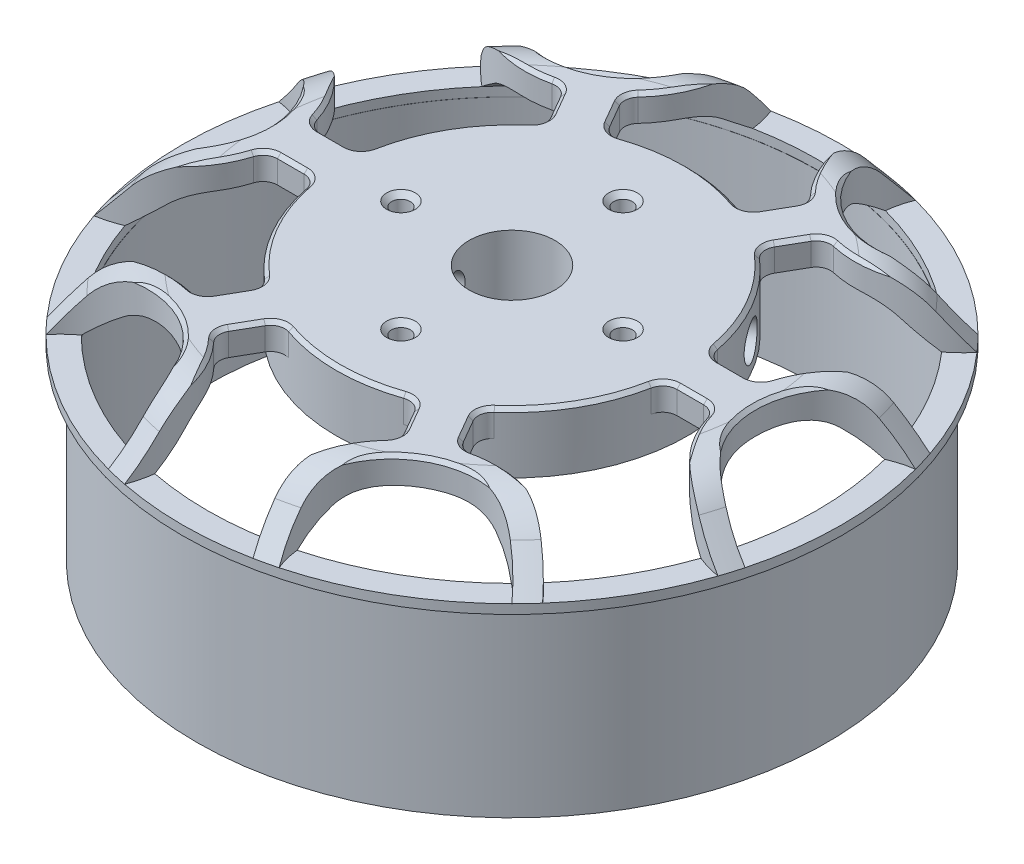
from build123d import *
from OCP.BRepAlgoAPI import BRepAlgoAPI_Cut
from OCP.TopTools import TopTools_ListOfShape

# Parameters (mm, degrees)
SKICA1_R                 = 44
SKICA1_R_2               = 42.5
P_IDAT_VYSUNUT_M1_DEPTH  = 27.3
P_IDAT_START             = -1.3
SKICA2_R                 = 46
SKICA2_R_2               = 44
P_IDAT_VYSUNUT_M2_DEPTH  = 1.3
SKICA3_R                 = 46
P_IDAT_VYSUNUT_M3_DEPTH  = 8.4
ODEBRAT_START            = -8.4
ODEBRAT_VYSUNUT_M2_DEPTH = 8.4
SKICA7_R                 = 1.3
SKICA7_R_2               = 6
ODEBRAT_VYSUNUT_M3_DEPTH = 75.205727542
SKICA9_R                 = 10
SKICA9_R_2               = 6
P_IDAT_VYSUNUT_M4_DEPTH  = 10.3
ZKOSEN_1_SIZE            = 0.5
ZKOSEN_2_SIZE            = 0.7
ZKOSEN_3_SIZE            = 1
M6_Z_VIT1_D              = 5


with BuildPart() as part:
    # Skica1 → Přidat vysunutím1 (new body)
    with BuildSketch(Plane(origin=(0, 0, 0), x_dir=(1, 0, 0), z_dir=(0, 1, 0))):
        with Locations(Location((0, 0, 0), (0, 0, 270))):
            Circle(SKICA1_R)
        with Locations(Location((0, 0, 0), (0, 0, 270))):
            Circle(SKICA1_R_2, mode=Mode.SUBTRACT)
    extrude(amount=P_IDAT_VYSUNUT_M1_DEPTH)

    # Skica2 → Přidat vysunutím2 (add)
    with BuildSketch(Plane(origin=(0, 27.3, 0), x_dir=(1, 0, 0), z_dir=(0, 1, 0)).offset(P_IDAT_START)):
        with Locations(Location((0, 0, 0), (0, 0, 270))):
            Circle(SKICA2_R)
        with Locations(Location((0, 0, 0), (0, 0, 270))):
            Circle(SKICA2_R_2, mode=Mode.SUBTRACT)
    extrude(amount=P_IDAT_VYSUNUT_M2_DEPTH)

    # Skica3 → Přidat vysunutím3 (add)
    with BuildSketch(Plane(origin=(0, 27.3, 0), x_dir=(1, 0, 0), z_dir=(0, 1, 0))):
        with Locations(Location((0, 0, 0), (0, 0, 270))):
            Circle(SKICA3_R)
    extrude(amount=P_IDAT_VYSUNUT_M3_DEPTH)

    # Skica5 → Odebrat rotací1 (revolve, cut)
    with BuildSketch(Plane(origin=(0, 0, 0), x_dir=(0, 0, -1), z_dir=(1, 0, 0)), mode=Mode.PRIVATE) as odebrat_rotac_1_sk:
        with BuildLine():
            Line((-34.288, 35.7), (-46, 35.7))
            Line((-46, 35.7), (-46, 27.3))
            Line((-46, 27.3), (-41.948064338, 32.128329047))
            ThreePointArc((-41.948064338, 32.128329047), (-38.513914666, 34.763202813), (-34.288, 35.7))
        make_face()
    revolve(odebrat_rotac_1_sk.sketch.rotate(Axis((0, 0, 0), (0, 1, 0)), 180), axis=Axis((0, 0, 0), (0, 1, 0)), mode=Mode.SUBTRACT)

    # Skica6 → Odebrat vysunutím2 (cut)
    with BuildSketch(Plane(origin=(0, 35.7, 0), x_dir=(1, 0, 0), z_dir=(0, 1, 0)).offset(ODEBRAT_START)):
        with BuildLine():
            Line((-15.610089891, 21.037468802), (-17.474037806, 24.265921293))
            ThreePointArc((-17.474037806, 24.265921293), (-18.406916047, 25.099312471), (-19.65243113, 25.215479797))
            ThreePointArc((-19.65243113, 25.215479797), (-27.84898156, 25.642543611), (-34.593729187, 30.319530025))
            ThreePointArc((-34.593729187, 30.319530025), (-39.837168574, 23), (-43.554347826, 14.799283275))
            ThreePointArc((-43.554347826, 14.799283275), (-36.131584966, 11.296653695), (-31.663461639, 4.411764706))
            ThreePointArc((-31.663461639, 4.411764706), (-30.940100242, 3.391200667), (-29.751923191, 3))
            Line((-29.751923191, 3), (-26.024027359, 3))
            ThreePointArc((-26.024027359, 3), (-24.750197893, 3.458131494), (-24.059949823, 4.622641509))
            ThreePointArc((-24.059949823, 4.622641509), (-21.217622393, 12.25), (-16.033299891, 18.525207006))
            ThreePointArc((-16.033299891, 18.525207006), (-15.36992867, 19.705234377), (-15.610089891, 21.037468802))
        make_face()
        with BuildLine():
            Line((10.413937468, 24.037468802), (12.277885383, 27.265921293))
            ThreePointArc((12.277885383, 27.265921293), (12.533184194, 28.490513138), (12.011030508, 29.627244503))
            ThreePointArc((12.011030508, 29.627244503), (8.282603404, 36.939197306), (8.960618639, 45.1188133))
            ThreePointArc((8.960618639, 45.1188133), (0, 46), (-8.960618639, 45.1188133))
            ThreePointArc((-8.960618639, 45.1188133), (-8.282603405, 36.939197307), (-12.011030509, 29.627244504))
            ThreePointArc((-12.011030509, 29.627244504), (-12.533184194, 28.490513139), (-12.277885384, 27.265921295))
            Line((-12.277885384, 27.265921295), (-10.413937468, 24.037468802))
            ThreePointArc((-10.413937468, 24.037468802), (-9.380269223, 23.163365871), (-8.026649932, 23.147848515))
            ThreePointArc((-8.026649932, 23.147848515), (0, 24.5), (8.026649932, 23.147848515))
            ThreePointArc((8.026649932, 23.147848515), (9.380269223, 23.163365871), (10.413937468, 24.037468802))
        make_face()
        with BuildLine():
            Line((26.024027359, 3), (29.751923189, 3))
            ThreePointArc((29.751923189, 3), (30.940100241, 3.391200667), (31.663461637, 4.411764706))
            ThreePointArc((31.663461637, 4.411764706), (36.131584965, 11.296653695), (43.554347826, 14.799283275))
            ThreePointArc((43.554347826, 14.799283275), (39.837168574, 23), (34.593729187, 30.319530025))
            ThreePointArc((34.593729187, 30.319530025), (27.84898156, 25.642543612), (19.65243113, 25.215479798))
            ThreePointArc((19.65243113, 25.215479798), (18.406916048, 25.099312472), (17.474037807, 24.265921295))
            Line((17.474037807, 24.265921295), (15.610089891, 21.037468802))
            ThreePointArc((15.610089891, 21.037468802), (15.36992867, 19.705234377), (16.033299891, 18.525207006))
            ThreePointArc((16.033299891, 18.525207006), (21.217622393, 12.25), (24.059949823, 4.622641509))
            ThreePointArc((24.059949823, 4.622641509), (24.750197893, 3.458131494), (26.024027359, 3))
        make_face()
        with BuildLine():
            Line((15.610089891, -21.037468802), (17.474037806, -24.265921293))
            ThreePointArc((17.474037806, -24.265921293), (18.406916047, -25.099312471), (19.65243113, -25.215479797))
            ThreePointArc((19.65243113, -25.215479797), (27.84898156, -25.642543611), (34.593729187, -30.319530025))
            ThreePointArc((34.593729187, -30.319530025), (39.837168574, -23), (43.554347826, -14.799283275))
            ThreePointArc((43.554347826, -14.799283275), (36.131584966, -11.296653695), (31.663461639, -4.411764706))
            ThreePointArc((31.663461639, -4.411764706), (30.940100242, -3.391200667), (29.751923191, -3))
            Line((29.751923191, -3), (26.024027359, -3))
            ThreePointArc((26.024027359, -3), (24.750197893, -3.458131494), (24.059949823, -4.622641509))
            ThreePointArc((24.059949823, -4.622641509), (21.217622393, -12.25), (16.033299891, -18.525207006))
            ThreePointArc((16.033299891, -18.525207006), (15.36992867, -19.705234377), (15.610089891, -21.037468802))
        make_face()
        with BuildLine():
            Line((-10.413937468, -24.037468802), (-12.277885383, -27.265921293))
            ThreePointArc((-12.277885383, -27.265921293), (-12.533184194, -28.490513138), (-12.011030508, -29.627244503))
            ThreePointArc((-12.011030508, -29.627244503), (-8.282603404, -36.939197306), (-8.960618639, -45.1188133))
            ThreePointArc((-8.960618639, -45.1188133), (0, -46), (8.960618639, -45.1188133))
            ThreePointArc((8.960618639, -45.1188133), (8.282603405, -36.939197307), (12.011030509, -29.627244504))
            ThreePointArc((12.011030509, -29.627244504), (12.533184194, -28.490513139), (12.277885384, -27.265921295))
            Line((12.277885384, -27.265921295), (10.413937468, -24.037468802))
            ThreePointArc((10.413937468, -24.037468802), (9.380269223, -23.163365871), (8.026649932, -23.147848515))
            ThreePointArc((8.026649932, -23.147848515), (0, -24.5), (-8.026649932, -23.147848515))
            ThreePointArc((-8.026649932, -23.147848515), (-9.380269223, -23.163365871), (-10.413937468, -24.037468802))
        make_face()
        with BuildLine():
            Line((-26.024027359, -3), (-29.751923189, -3))
            ThreePointArc((-29.751923189, -3), (-30.940100241, -3.391200667), (-31.663461637, -4.411764706))
            ThreePointArc((-31.663461637, -4.411764706), (-36.131584965, -11.296653695), (-43.554347826, -14.799283275))
            ThreePointArc((-43.554347826, -14.799283275), (-39.837168574, -23), (-34.593729187, -30.319530025))
            ThreePointArc((-34.593729187, -30.319530025), (-27.84898156, -25.642543612), (-19.65243113, -25.215479798))
            ThreePointArc((-19.65243113, -25.215479798), (-18.406916048, -25.099312472), (-17.474037807, -24.265921295))
            Line((-17.474037807, -24.265921295), (-15.610089891, -21.037468802))
            ThreePointArc((-15.610089891, -21.037468802), (-15.36992867, -19.705234377), (-16.033299891, -18.525207006))
            ThreePointArc((-16.033299891, -18.525207006), (-21.217622393, -12.25), (-24.059949823, -4.622641509))
            ThreePointArc((-24.059949823, -4.622641509), (-24.750197893, -3.458131494), (-26.024027359, -3))
        make_face()
        with BuildLine():
            ThreePointArc((-44.434782609, 11.897482697), (-34, 0), (-44.434782609, -11.897482697))
            ThreePointArc((-44.434782609, -11.897482697), (-46, 0), (-44.434782609, 11.897482697))
        make_face()
        with BuildLine():
            ThreePointArc((-11.913869048, 44.430391899), (-17, 29.444863729), (-32.520913561, 32.532909202))
            ThreePointArc((-32.520913561, 32.532909202), (-23, 39.837168574), (-11.913869048, 44.430391899))
        make_face()
        with BuildLine():
            ThreePointArc((32.520913561, 32.532909202), (17, 29.444863729), (11.913869048, 44.430391899))
            ThreePointArc((11.913869048, 44.430391899), (23, 39.837168574), (32.520913561, 32.532909202))
        make_face()
        with BuildLine():
            ThreePointArc((44.434782609, -11.897482697), (34, 0), (44.434782609, 11.897482697))
            ThreePointArc((44.434782609, 11.897482697), (46, 0), (44.434782609, -11.897482697))
        make_face()
        with BuildLine():
            ThreePointArc((11.913869048, -44.430391899), (17, -29.444863729), (32.520913561, -32.532909202))
            ThreePointArc((32.520913561, -32.532909202), (23, -39.837168574), (11.913869048, -44.430391899))
        make_face()
        with BuildLine():
            ThreePointArc((-32.520913561, -32.532909202), (-17, -29.444863729), (-11.913869048, -44.430391899))
            ThreePointArc((-11.913869048, -44.430391899), (-23, -39.837168574), (-32.520913561, -32.532909202))
        make_face()
    extrude(amount=ODEBRAT_VYSUNUT_M2_DEPTH, mode=Mode.SUBTRACT)

    # Skica7 → Odebrat vysunutím3 (cut, through all)
    with BuildSketch(Plane(origin=(0, 35.7, 0), x_dir=(1, 0, 0), z_dir=(0, 1, 0))):
        with Locations(Location((0, 15.5, 0), (0, 0, 270))):
            Circle(SKICA7_R)
        with Locations(Location((15.5, 0, 0), (0, 0, 270))):
            Circle(SKICA7_R)
        with Locations(Location((0, -15.5, 0), (0, 0, 270))):
            Circle(SKICA7_R)
        with Locations(Location((-15.5, 0, 0), (0, 0, 270))):
            Circle(SKICA7_R)
        with Locations(Location((0, 0, 0), (0, 0, 270))):
            Circle(SKICA7_R_2)
    extrude(amount=-ODEBRAT_VYSUNUT_M3_DEPTH, mode=Mode.SUBTRACT)

    # Skica9 → Přidat vysunutím4 (add)
    with BuildSketch(Plane.XZ.offset(-27.3)):
        with Locations(Location((0, 0, 0), (0, 0, 90))):
            Circle(SKICA9_R)
        with Locations(Location((0, 0, 0), (0, 0, 90))):
            Circle(SKICA9_R_2, mode=Mode.SUBTRACT)
    extrude(amount=P_IDAT_VYSUNUT_M4_DEPTH)

    # Skica10 → Odebrat rotací2 (revolve, cut)
    with BuildSketch(Plane(origin=(0, 0, 0), x_dir=(0, 0, -1), z_dir=(1, 0, 0))):
        with BuildLine():
            Line((-24.5, 27.3), (-24.5, 32.030323323))
            Line((-24.5, 32.030323323), (-34.288, 32.030323323))
            ThreePointArc((-34.288, 32.030323323), (-36.424890419, 31.669028344), (-38.324227676, 30.625307734))
            Line((-38.324227676, 30.625307734), (-42.521808295, 27.3))
            Line((-42.521808295, 27.3), (-42.521808295, 26))
            Line((-42.521808295, 26), (-24.5, 26))
            Line((-24.5, 26), (-24.5, 27.3))
        make_face()
    revolve(axis=Axis((0, 0, 0), (0, 1, 0)), mode=Mode.SUBTRACT)

    # Zkosení1
    # the kernel refuses this chamfer: 0.5 mm, written as the material it takes off along each edge
    with BuildSketch(Plane(origin=(-45.999999999, 35.7, 0), x_dir=(0.9557692240704767, 0, 0.294117647072934), z_dir=(0.294117647072934, 0, -0.9557692240704767))) as zkosen_1_piece_1:
        Polygon((15, ZKOSEN_1_SIZE), (15 - ZKOSEN_1_SIZE, 0), (15, 0), align=None)
    revolve(axis=Axis((-45.999999999, 35.7, 0), (0, -1, 0)), revolution_arc=39.840972822, mode=Mode.SUBTRACT)
    with BuildSketch(Plane(origin=(-29.751923189, 35.7, 5), x_dir=(0, 0, -1), z_dir=(1, 0, 0))) as zkosen_1_piece_2:
        Polygon((2 + ZKOSEN_1_SIZE, 0), (2, -ZKOSEN_1_SIZE), (2, 0), align=None)
    revolve(axis=Axis((-29.751923189, 35.7, 5), (0, 1, 0)), revolution_arc=72.895364823, mode=Mode.SUBTRACT)
    with BuildSketch(Plane(origin=(-26.024027359, 35.7, 3), x_dir=(0, 0, -1), z_dir=(-1, 0, 0))) as zkosen_1_piece_3:
        Polygon((ZKOSEN_1_SIZE, 0), (0, ZKOSEN_1_SIZE), (0, 0), align=None)
    extrude(amount=3.72789583, mode=Mode.SUBTRACT)
    with BuildSketch(Plane(origin=(-23, 35.7, 39.837168574), x_dir=(-0.45314444531762665, 0, -0.8914371047234799), z_dir=(-0.8914371047234799, 0, 0.45314444531762665))) as zkosen_1_piece_4:
        Polygon((15, ZKOSEN_1_SIZE), (15 - ZKOSEN_1_SIZE, 0), (15, 0), align=None)
    revolve(axis=Axis((-23, 35.7, 39.837168574), (0, -1, 0)), revolution_arc=39.840972815, mode=Mode.SUBTRACT)
    with BuildSketch(Plane(origin=(-19.206088614, 35.7, 23.265921295), x_dir=(-0.22317125798319623, 0, 0.9747792517335387), z_dir=(-0.9747792517335387, 0, -0.22317125798319623))) as zkosen_1_piece_5:
        Polygon((2 + ZKOSEN_1_SIZE, 0), (2, -ZKOSEN_1_SIZE), (2, 0), align=None)
    revolve(axis=Axis((-19.206088614, 35.7, 23.265921295), (0, 1, 0)), revolution_arc=72.895364823, mode=Mode.SUBTRACT)
    with BuildSketch(Plane(origin=(-17.474037807, 35.7, 24.265921295), x_dir=(0.8660254037844303, 0, 0.5000000000000144), z_dir=(0.5000000000000145, 0, -0.8660254037844304))) as zkosen_1_piece_6:
        Polygon((ZKOSEN_1_SIZE, 0), (0, ZKOSEN_1_SIZE), (0, 0), align=None)
    extrude(amount=3.727895831, mode=Mode.SUBTRACT)
    with BuildSketch(Plane(origin=(0, 35.7, 0), x_dir=(-0.6544204037205466, 0, 0.7561308981877655), z_dir=(0.7561308981877655, 0, 0.6544204037205466))) as zkosen_1_piece_7:
        Polygon((24.5 - ZKOSEN_1_SIZE, 0), (24.5, ZKOSEN_1_SIZE), (24.5, 0), align=None)
    revolve(axis=Axis((0, 35.7, 0), (0, -1, 0)), revolution_arc=38.248567011, mode=Mode.SUBTRACT)
    with BuildSketch(Plane(origin=(-46, 35.7, 0), x_dir=(0.7486212377968893, 0, -0.6629979202979852), z_dir=(-0.6629979202979852, 0, -0.7486212377968893))) as zkosen_1_piece_8:
        Polygon((12, ZKOSEN_1_SIZE), (12 + ZKOSEN_1_SIZE, 0), (12, 0), align=None)
    revolve(axis=Axis((-46, 35.7, 0), (0, -1, 0)), revolution_arc=83.057828013, mode=Mode.SUBTRACT)
    with BuildSketch(Plane(origin=(-17.342140699, 35.7, 20.037468802), x_dir=(0.8660254037843677, 0, 0.5000000000001229), z_dir=(-0.5000000000001229, 0, 0.8660254037843677))) as zkosen_1_piece_9:
        Polygon((2 + ZKOSEN_1_SIZE, 0), (2, -ZKOSEN_1_SIZE), (2, 0), align=None)
    revolve(axis=Axis((-17.342140699, 35.7, 20.037468802), (0, 1, 0)), revolution_arc=79.124283505, mode=Mode.SUBTRACT)
    with BuildSketch(Plane(origin=(-26.024027359, 35.7, 5), x_dir=(0.9820387682772246, 0, -0.18867924528297125), z_dir=(0.18867924528297125, 0, 0.9820387682772246))) as zkosen_1_piece_10:
        Polygon((2 + ZKOSEN_1_SIZE, 0), (2, -ZKOSEN_1_SIZE), (2, 0), align=None)
    revolve(axis=Axis((-26.024027359, 35.7, 5), (0, 1, 0)), revolution_arc=79.124283505, mode=Mode.SUBTRACT)


with BuildPart() as kruhov_pole1_tool:
    # Kruhové pole1: read off the stored shape, not the designer's step
    # Kruhové pole1: loft between two sections, ruled curve by curve
    kruhov_pole1_from = [
        Edge.make_three_point_arc((-36.107905282, 35.700000506, -10.601719078), (-33.709192786, 35.700000506, -7.693246607), (-32.141346735, 35.700000506, -4.264705734)),
        Edge.make_three_point_arc((-23.568930439, 35.7, -4.528301887), (-20.784609691, 35.7, -12), (-15.706089689, 35.7, -18.147141557)),
        Edge.make_three_point_arc((-19.764016871, 35.700000506, -25.702869916), (-23.517143392, 35.700000506, -25.346393989), (-27.235310687, 35.700000506, -25.969503712)),
        Edge.make_three_point_arc((-32.141346735, 35.700000506, -4.264705734), (-31.237144505, 35.7, -2.989000834), (-29.751923191, 35.7, -2.5)),
        Edge.make_three_point_arc((-17.041025104, 35.7, -24.515921293), (-18.207122906, 35.7, -25.557660265), (-19.764016871, 35.700000506, -25.702869916)),
        Edge.make_three_point_arc((-15.706089689, 35.7, -18.147141557), (-14.876875662, 35.7, -19.622175771), (-15.177077189, 35.7, -21.287468802)),
        Edge.make_three_point_arc((-26.024027359, 35.7, -2.5), (-24.431740526, 35.7, -3.072664367), (-23.568930439, 35.7, -4.528301887)),
        Edge.make_line((-17.041025104, 35.7, -24.515921293), (-15.177077189, 35.7, -21.287468802)),
        Edge.make_line((-29.751923191, 35.7, -2.5), (-26.024027359, 35.7, -2.5)),
        Edge.make_line((-27.235310687, 35.700000506, -25.969503712), (-36.107905282, 35.700000506, -10.601719078)),
    ]
    kruhov_pole1_to = [
        Edge.make_three_point_arc((-35.766798211, 35.2, -10.967295981), (-33.285371404, 35.2, -7.95853125), (-31.663461639, 35.2, -4.411764706)),
        Edge.make_three_point_arc((-24.059949823, 35.2, -4.622641509), (-21.217622393, 35.2, -12.25), (-16.033299891, 35.2, -18.525207006)),
        Edge.make_three_point_arc((-19.65243113, 35.2, -25.215479797), (-23.534975941, 35.2, -24.846711584), (-27.381356036, 35.2, -25.491307871)),
        Edge.make_three_point_arc((-31.663461639, 35.2, -4.411764706), (-30.940100242, 35.2, -3.391200667), (-29.751923191, 35.2, -3)),
        Edge.make_three_point_arc((-17.474037806, 35.2, -24.265921293), (-18.406916047, 35.2, -25.099312471), (-19.65243113, 35.2, -25.215479797)),
        Edge.make_three_point_arc((-16.033299891, 35.2, -18.525207006), (-15.36992867, 35.2, -19.705234377), (-15.610089891, 35.2, -21.037468802)),
        Edge.make_three_point_arc((-26.024027359, 35.2, -3), (-24.750197893, 35.2, -3.458131494), (-24.059949823, 35.2, -4.622641509)),
        Edge.make_line((-17.474037806, 35.2, -24.265921293), (-15.610089891, 35.2, -21.037468802)),
        Edge.make_line((-29.751923191, 35.2, -3), (-26.024027359, 35.2, -3)),
        Edge.make_line((-27.381356036, 35.2, -25.491307871), (-35.766798211, 35.2, -10.967295981)),
    ]
    kruhov_pole1 = Solid(Shell([*[Face.make_surface_from_curves(kruhov_pole1_from[k], kruhov_pole1_to[k]) for k in range(10)], Face(Wire(kruhov_pole1_from)), Face(Wire(kruhov_pole1_to))]))
    add(kruhov_pole1)


with BuildPart() as part_1:
    add(part.part)

    # Kruhové pole1: cut by kruhov_pole1_tool, with a tolerance
    kruhov_pole1_stock = TopTools_ListOfShape()
    kruhov_pole1_stock.Append(part_1.part.wrapped)
    kruhov_pole1_tools = TopTools_ListOfShape()
    kruhov_pole1_tools.Append(kruhov_pole1_tool.part.wrapped)
    kruhov_pole1_cut = BRepAlgoAPI_Cut()
    kruhov_pole1_cut.SetArguments(kruhov_pole1_stock)
    kruhov_pole1_cut.SetTools(kruhov_pole1_tools)
    kruhov_pole1_cut.SetFuzzyValue(0.00001)
    kruhov_pole1_cut.Build()
    add(Compound.cast(kruhov_pole1_cut.Shape()).solids(), mode=Mode.REPLACE)


with BuildPart() as kruhov_pole1_2_tool:
    # Kruhov_ pole1 2: loft between two sections, ruled curve by curve
    kruhov_pole1_2_from = [
        Edge.make_three_point_arc((-12.377329862, 35.700000506, 29.96757565), (-10.192049393, 35.700000506, 33.039640596), (-8.872594595, 35.700000506, 36.571222791)),
        Edge.make_three_point_arc((7.862840749, 35.7, 22.675443443), (0, 35.7, 24), (-7.862840749, 35.7, 22.675443443)),
        Edge.make_three_point_arc((8.872594595, 35.700000506, 36.571222791), (10.192049394, 35.700000506, 33.039640597), (12.377329862, 35.700000506, 29.967575651)),
        Edge.make_three_point_arc((12.377329862, 35.700000506, 29.967575651), (13.030021599, 35.7, 28.5466611), (12.710898086, 35.7, 27.015921295)),
        Edge.make_three_point_arc((-12.710898085, 35.7, 27.015921293), (-13.030021598, 35.7, 28.546661099), (-12.377329862, 35.700000506, 29.96757565)),
        Edge.make_three_point_arc((-7.862840749, 35.7, 22.675443443), (-9.554864864, 35.7, 22.694840138), (-10.84695017, 35.7, 23.787468802)),
        Edge.make_three_point_arc((10.84695017, 35.7, 23.787468802), (9.554864864, 35.7, 22.694840138), (7.862840749, 35.7, 22.675443443)),
        Edge.make_line((12.710898086, 35.7, 27.015921295), (10.84695017, 35.7, 23.787468802)),
        Edge.make_line((-12.710898085, 35.7, 27.015921293), (-10.84695017, 35.7, 23.787468802)),
        Edge.make_line((8.872594595, 35.700000506, 36.571222791), (-8.872594595, 35.700000506, 36.571222791)),
    ]
    kruhov_pole1_2_to = [
        Edge.make_three_point_arc((-12.011030508, 35.2, 29.627244503), (-9.750395462, 35.2, 32.805242834), (-8.385442174, 35.2, 36.458603853)),
        Edge.make_three_point_arc((8.026649932, 35.2, 23.147848515), (0, 35.2, 24.5), (-8.026649932, 35.2, 23.147848515)),
        Edge.make_three_point_arc((8.385442175, 35.2, 36.458603853), (9.750395462, 35.2, 32.805242835), (12.011030509, 35.2, 29.627244504)),
        Edge.make_three_point_arc((12.011030509, 35.2, 29.627244504), (12.533184194, 35.2, 28.490513139), (12.277885384, 35.2, 27.265921295)),
        Edge.make_three_point_arc((-12.277885383, 35.2, 27.265921293), (-12.533184194, 35.2, 28.490513138), (-12.011030508, 35.2, 29.627244503)),
        Edge.make_three_point_arc((-8.026649932, 35.2, 23.147848515), (-9.380269223, 35.2, 23.163365871), (-10.413937468, 35.2, 24.037468802)),
        Edge.make_three_point_arc((10.413937468, 35.2, 24.037468802), (9.380269223, 35.2, 23.163365871), (8.026649932, 35.2, 23.147848515)),
        Edge.make_line((12.277885384, 35.2, 27.265921295), (10.413937468, 35.2, 24.037468802)),
        Edge.make_line((-12.277885383, 35.2, 27.265921293), (-10.413937468, 35.2, 24.037468802)),
        Edge.make_line((8.385442175, 35.2, 36.458603853), (-8.385442174, 35.2, 36.458603853)),
    ]
    kruhov_pole1_2 = Solid(Shell([*[Face.make_surface_from_curves(kruhov_pole1_2_from[k], kruhov_pole1_2_to[k]) for k in range(10)], Face(Wire(kruhov_pole1_2_from)), Face(Wire(kruhov_pole1_2_to))]))
    add(kruhov_pole1_2)


with BuildPart() as part_2:
    add(part_1.part)

    # Kruhov_ pole1 2: cut by kruhov_pole1_2_tool, with a tolerance
    kruhov_pole1_2_stock = TopTools_ListOfShape()
    kruhov_pole1_2_stock.Append(part_2.part.wrapped)
    kruhov_pole1_2_tools = TopTools_ListOfShape()
    kruhov_pole1_2_tools.Append(kruhov_pole1_2_tool.part.wrapped)
    kruhov_pole1_2_cut = BRepAlgoAPI_Cut()
    kruhov_pole1_2_cut.SetArguments(kruhov_pole1_2_stock)
    kruhov_pole1_2_cut.SetTools(kruhov_pole1_2_tools)
    kruhov_pole1_2_cut.SetFuzzyValue(0.00001)
    kruhov_pole1_2_cut.Build()
    add(Compound.cast(kruhov_pole1_2_cut.Shape()).solids(), mode=Mode.REPLACE)


with BuildPart() as kruhov_pole1_3_tool:
    # Kruhov_ pole1 3: loft between two sections, ruled curve by curve
    kruhov_pole1_3_from = [
        Edge.make_three_point_arc((23.568930439, 35.7, 4.528301887), (20.784609691, 35.7, 12), (15.706089689, 35.7, 18.147141557)),
        Edge.make_three_point_arc((19.764016871, 35.700000506, 25.702869916), (23.517143392, 35.700000506, 25.346393989), (27.235310687, 35.700000506, 25.969503712)),
        Edge.make_three_point_arc((36.107905282, 35.700000506, 10.601719078), (33.709192786, 35.700000506, 7.693246607), (32.141346735, 35.700000506, 4.264705734)),
        Edge.make_three_point_arc((32.141346735, 35.700000506, 4.264705734), (31.237144505, 35.7, 2.989000834), (29.751923191, 35.7, 2.5)),
        Edge.make_three_point_arc((17.041025104, 35.7, 24.515921293), (18.207122906, 35.7, 25.557660265), (19.764016871, 35.700000506, 25.702869916)),
        Edge.make_three_point_arc((15.706089689, 35.7, 18.147141557), (14.876875662, 35.7, 19.622175771), (15.177077189, 35.7, 21.287468802)),
        Edge.make_three_point_arc((26.024027359, 35.7, 2.5), (24.431740526, 35.7, 3.072664367), (23.568930439, 35.7, 4.528301887)),
        Edge.make_line((29.751923191, 35.7, 2.5), (26.024027359, 35.7, 2.5)),
        Edge.make_line((17.041025104, 35.7, 24.515921293), (15.177077189, 35.7, 21.287468802)),
        Edge.make_line((36.107905282, 35.700000506, 10.601719078), (27.235310687, 35.700000506, 25.969503712)),
    ]
    kruhov_pole1_3_to = [
        Edge.make_three_point_arc((24.059949823, 35.2, 4.622641509), (21.217622393, 35.2, 12.25), (16.033299891, 35.2, 18.525207006)),
        Edge.make_three_point_arc((19.65243113, 35.2, 25.215479797), (23.534975941, 35.2, 24.846711584), (27.381356036, 35.2, 25.491307871)),
        Edge.make_three_point_arc((35.766798211, 35.2, 10.967295981), (33.285371404, 35.2, 7.95853125), (31.663461639, 35.2, 4.411764706)),
        Edge.make_three_point_arc((31.663461639, 35.2, 4.411764706), (30.940100242, 35.2, 3.391200667), (29.751923191, 35.2, 3)),
        Edge.make_three_point_arc((17.474037806, 35.2, 24.265921293), (18.406916047, 35.2, 25.099312471), (19.65243113, 35.2, 25.215479797)),
        Edge.make_three_point_arc((16.033299891, 35.2, 18.525207006), (15.36992867, 35.2, 19.705234377), (15.610089891, 35.2, 21.037468802)),
        Edge.make_three_point_arc((26.024027359, 35.2, 3), (24.750197893, 35.2, 3.458131494), (24.059949823, 35.2, 4.622641509)),
        Edge.make_line((29.751923191, 35.2, 3), (26.024027359, 35.2, 3)),
        Edge.make_line((17.474037806, 35.2, 24.265921293), (15.610089891, 35.2, 21.037468802)),
        Edge.make_line((35.766798211, 35.2, 10.967295981), (27.381356036, 35.2, 25.491307871)),
    ]
    kruhov_pole1_3 = Solid(Shell([*[Face.make_surface_from_curves(kruhov_pole1_3_from[k], kruhov_pole1_3_to[k]) for k in range(10)], Face(Wire(kruhov_pole1_3_from)), Face(Wire(kruhov_pole1_3_to))]))
    add(kruhov_pole1_3)


with BuildPart() as part_3:
    add(part_2.part)

    # Kruhov_ pole1 3: cut by kruhov_pole1_3_tool, with a tolerance
    kruhov_pole1_3_stock = TopTools_ListOfShape()
    kruhov_pole1_3_stock.Append(part_3.part.wrapped)
    kruhov_pole1_3_tools = TopTools_ListOfShape()
    kruhov_pole1_3_tools.Append(kruhov_pole1_3_tool.part.wrapped)
    kruhov_pole1_3_cut = BRepAlgoAPI_Cut()
    kruhov_pole1_3_cut.SetArguments(kruhov_pole1_3_stock)
    kruhov_pole1_3_cut.SetTools(kruhov_pole1_3_tools)
    kruhov_pole1_3_cut.SetFuzzyValue(0.00001)
    kruhov_pole1_3_cut.Build()
    add(Compound.cast(kruhov_pole1_3_cut.Shape()).solids(), mode=Mode.REPLACE)


with BuildPart() as kruhov_pole1_4_tool:
    # Kruhov_ pole1 4: loft between two sections, ruled curve by curve
    kruhov_pole1_4_from = [
        Edge.make_three_point_arc((-7.862840749, 35.7, -22.675443443), (0, 35.7, -24), (7.862840749, 35.7, -22.675443443)),
        Edge.make_three_point_arc((12.377329862, 35.700000506, -29.96757565), (10.192049393, 35.700000506, -33.039640596), (8.872594595, 35.700000506, -36.571222791)),
        Edge.make_three_point_arc((-8.872594595, 35.700000506, -36.571222791), (-10.192049394, 35.700000506, -33.039640597), (-12.377329862, 35.700000506, -29.967575651)),
        Edge.make_three_point_arc((-12.377329862, 35.700000506, -29.967575651), (-13.030021599, 35.7, -28.5466611), (-12.710898086, 35.7, -27.015921295)),
        Edge.make_three_point_arc((12.710898085, 35.7, -27.015921293), (13.030021598, 35.7, -28.546661099), (12.377329862, 35.700000506, -29.96757565)),
        Edge.make_three_point_arc((7.862840749, 35.7, -22.675443443), (9.554864864, 35.7, -22.694840138), (10.84695017, 35.7, -23.787468802)),
        Edge.make_three_point_arc((-10.84695017, 35.7, -23.787468802), (-9.554864864, 35.7, -22.694840138), (-7.862840749, 35.7, -22.675443443)),
        Edge.make_line((12.710898085, 35.7, -27.015921293), (10.84695017, 35.7, -23.787468802)),
        Edge.make_line((-12.710898086, 35.7, -27.015921295), (-10.84695017, 35.7, -23.787468802)),
        Edge.make_line((-8.872594595, 35.700000506, -36.571222791), (8.872594595, 35.700000506, -36.571222791)),
    ]
    kruhov_pole1_4_to = [
        Edge.make_three_point_arc((-8.026649932, 35.2, -23.147848515), (0, 35.2, -24.5), (8.026649932, 35.2, -23.147848515)),
        Edge.make_three_point_arc((12.011030508, 35.2, -29.627244503), (9.750395462, 35.2, -32.805242834), (8.385442174, 35.2, -36.458603853)),
        Edge.make_three_point_arc((-8.385442175, 35.2, -36.458603853), (-9.750395462, 35.2, -32.805242835), (-12.011030509, 35.2, -29.627244504)),
        Edge.make_three_point_arc((-12.011030509, 35.2, -29.627244504), (-12.533184194, 35.2, -28.490513139), (-12.277885384, 35.2, -27.265921295)),
        Edge.make_three_point_arc((12.277885383, 35.2, -27.265921293), (12.533184194, 35.2, -28.490513138), (12.011030508, 35.2, -29.627244503)),
        Edge.make_three_point_arc((8.026649932, 35.2, -23.147848515), (9.380269223, 35.2, -23.163365871), (10.413937468, 35.2, -24.037468802)),
        Edge.make_three_point_arc((-10.413937468, 35.2, -24.037468802), (-9.380269223, 35.2, -23.163365871), (-8.026649932, 35.2, -23.147848515)),
        Edge.make_line((12.277885383, 35.2, -27.265921293), (10.413937468, 35.2, -24.037468802)),
        Edge.make_line((-12.277885384, 35.2, -27.265921295), (-10.413937468, 35.2, -24.037468802)),
        Edge.make_line((-8.385442175, 35.2, -36.458603853), (8.385442174, 35.2, -36.458603853)),
    ]
    kruhov_pole1_4 = Solid(Shell([*[Face.make_surface_from_curves(kruhov_pole1_4_from[k], kruhov_pole1_4_to[k]) for k in range(10)], Face(Wire(kruhov_pole1_4_from)), Face(Wire(kruhov_pole1_4_to))]))
    add(kruhov_pole1_4)


with BuildPart() as part_4:
    add(part_3.part)

    # Kruhov_ pole1 4: cut by kruhov_pole1_4_tool, with a tolerance
    kruhov_pole1_4_stock = TopTools_ListOfShape()
    kruhov_pole1_4_stock.Append(part_4.part.wrapped)
    kruhov_pole1_4_tools = TopTools_ListOfShape()
    kruhov_pole1_4_tools.Append(kruhov_pole1_4_tool.part.wrapped)
    kruhov_pole1_4_cut = BRepAlgoAPI_Cut()
    kruhov_pole1_4_cut.SetArguments(kruhov_pole1_4_stock)
    kruhov_pole1_4_cut.SetTools(kruhov_pole1_4_tools)
    kruhov_pole1_4_cut.SetFuzzyValue(0.00001)
    kruhov_pole1_4_cut.Build()
    add(Compound.cast(kruhov_pole1_4_cut.Shape()).solids(), mode=Mode.REPLACE)


with BuildPart() as kruhov_pole1_5_tool:
    # Kruhov_ pole1 5: loft between two sections, ruled curve by curve
    kruhov_pole1_5_from = [
        Edge.make_three_point_arc((15.706089689, 35.7, -18.147141557), (20.784609691, 35.7, -12), (23.568930439, 35.7, -4.528301887)),
        Edge.make_three_point_arc((32.141346733, 35.700000506, -4.264705733), (33.709192785, 35.700000506, -7.693246607), (36.107905282, 35.700000506, -10.601719079)),
        Edge.make_three_point_arc((27.235310687, 35.700000506, -25.969503713), (23.517143392, 35.700000506, -25.34639399), (19.764016872, 35.700000506, -25.702869917)),
        Edge.make_three_point_arc((19.764016872, 35.700000506, -25.702869917), (18.207122906, 35.7, -25.557660266), (17.041025105, 35.7, -24.515921295)),
        Edge.make_three_point_arc((29.751923189, 35.7, -2.5), (31.237144504, 35.7, -2.989000834), (32.141346733, 35.700000506, -4.264705733)),
        Edge.make_three_point_arc((23.568930439, 35.7, -4.528301887), (24.431740526, 35.7, -3.072664367), (26.024027359, 35.7, -2.5)),
        Edge.make_three_point_arc((15.177077189, 35.7, -21.287468802), (14.876875662, 35.7, -19.622175771), (15.706089689, 35.7, -18.147141557)),
        Edge.make_line((17.041025105, 35.7, -24.515921295), (15.177077189, 35.7, -21.287468802)),
        Edge.make_line((29.751923189, 35.7, -2.5), (26.024027359, 35.7, -2.5)),
        Edge.make_line((27.235310687, 35.700000506, -25.969503713), (36.107905282, 35.700000506, -10.601719079)),
    ]
    kruhov_pole1_5_to = [
        Edge.make_three_point_arc((16.033299891, 35.2, -18.525207006), (21.217622393, 35.2, -12.25), (24.059949823, 35.2, -4.622641509)),
        Edge.make_three_point_arc((31.663461637, 35.2, -4.411764706), (33.285371403, 35.2, -7.958531251), (35.76679821, 35.2, -10.967295982)),
        Edge.make_three_point_arc((27.381356036, 35.2, -25.491307872), (23.534975941, 35.2, -24.846711585), (19.65243113, 35.2, -25.215479798)),
        Edge.make_three_point_arc((19.65243113, 35.2, -25.215479798), (18.406916048, 35.2, -25.099312472), (17.474037807, 35.2, -24.265921295)),
        Edge.make_three_point_arc((29.751923189, 35.2, -3), (30.940100241, 35.2, -3.391200667), (31.663461637, 35.2, -4.411764706)),
        Edge.make_three_point_arc((24.059949823, 35.2, -4.622641509), (24.750197893, 35.2, -3.458131494), (26.024027359, 35.2, -3)),
        Edge.make_three_point_arc((15.610089891, 35.2, -21.037468802), (15.36992867, 35.2, -19.705234377), (16.033299891, 35.2, -18.525207006)),
        Edge.make_line((17.474037807, 35.2, -24.265921295), (15.610089891, 35.2, -21.037468802)),
        Edge.make_line((29.751923189, 35.2, -3), (26.024027359, 35.2, -3)),
        Edge.make_line((27.381356036, 35.2, -25.491307872), (35.76679821, 35.2, -10.967295982)),
    ]
    kruhov_pole1_5 = Solid(Shell([*[Face.make_surface_from_curves(kruhov_pole1_5_from[k], kruhov_pole1_5_to[k]) for k in range(10)], Face(Wire(kruhov_pole1_5_from)), Face(Wire(kruhov_pole1_5_to))]))
    add(kruhov_pole1_5)


with BuildPart() as part_5:
    add(part_4.part)

    # Kruhov_ pole1 5: cut by kruhov_pole1_5_tool, with a tolerance
    kruhov_pole1_5_stock = TopTools_ListOfShape()
    kruhov_pole1_5_stock.Append(part_5.part.wrapped)
    kruhov_pole1_5_tools = TopTools_ListOfShape()
    kruhov_pole1_5_tools.Append(kruhov_pole1_5_tool.part.wrapped)
    kruhov_pole1_5_cut = BRepAlgoAPI_Cut()
    kruhov_pole1_5_cut.SetArguments(kruhov_pole1_5_stock)
    kruhov_pole1_5_cut.SetTools(kruhov_pole1_5_tools)
    kruhov_pole1_5_cut.SetFuzzyValue(0.00001)
    kruhov_pole1_5_cut.Build()
    add(Compound.cast(kruhov_pole1_5_cut.Shape()).solids(), mode=Mode.REPLACE)


with BuildPart() as kruhov_pole1_6_tool:
    # Kruhov_ pole1 6: loft between two sections, ruled curve by curve
    kruhov_pole1_6_from = [
        Edge.make_three_point_arc((-11.812525038, 35.2, 35.496615157), (-17, 35.2, 29.444863729), (-24.834707956, 35.2, 27.978254344)),
        Edge.make_line((-24.834707956, 35.2, 27.978254344), (-11.812525038, 35.2, 35.496615157)),
    ]
    kruhov_pole1_6_to = [
        Edge.make_three_point_arc((-11.346380248, 35.7, 35.315758765), (-16.75, 35.7, 29.011851027), (-24.91115412, 35.7, 27.484132918)),
        Edge.make_line((-24.91115412, 35.7, 27.484132918), (-11.346380248, 35.7, 35.315758765)),
    ]
    kruhov_pole1_6 = Solid(Shell([*[Face.make_surface_from_curves(kruhov_pole1_6_from[k], kruhov_pole1_6_to[k]) for k in range(2)], Face(Wire(kruhov_pole1_6_from)), Face(Wire(kruhov_pole1_6_to))]))
    add(kruhov_pole1_6)


with BuildPart() as part_6:
    add(part_5.part)

    # Kruhov_ pole1 6: cut by kruhov_pole1_6_tool, with a tolerance
    kruhov_pole1_6_stock = TopTools_ListOfShape()
    kruhov_pole1_6_stock.Append(part_6.part.wrapped)
    kruhov_pole1_6_tools = TopTools_ListOfShape()
    kruhov_pole1_6_tools.Append(kruhov_pole1_6_tool.part.wrapped)
    kruhov_pole1_6_cut = BRepAlgoAPI_Cut()
    kruhov_pole1_6_cut.SetArguments(kruhov_pole1_6_stock)
    kruhov_pole1_6_cut.SetTools(kruhov_pole1_6_tools)
    kruhov_pole1_6_cut.SetFuzzyValue(0.00001)
    kruhov_pole1_6_cut.Build()
    add(Compound.cast(kruhov_pole1_6_cut.Shape()).solids(), mode=Mode.REPLACE)


with BuildPart() as kruhov_pole1_7_tool:
    # Kruhov_ pole1 7: loft between two sections, ruled curve by curve
    kruhov_pole1_7_from = [
        Edge.make_three_point_arc((24.834707956, 35.2, 27.978254344), (17, 35.2, 29.444863729), (11.812525038, 35.2, 35.496615157)),
        Edge.make_line((11.812525038, 35.2, 35.496615157), (24.834707956, 35.2, 27.978254344)),
    ]
    kruhov_pole1_7_to = [
        Edge.make_three_point_arc((24.91115412, 35.7, 27.484132918), (16.75, 35.7, 29.011851027), (11.346380248, 35.7, 35.315758765)),
        Edge.make_line((11.346380248, 35.7, 35.315758765), (24.91115412, 35.7, 27.484132918)),
    ]
    kruhov_pole1_7 = Solid(Shell([*[Face.make_surface_from_curves(kruhov_pole1_7_from[k], kruhov_pole1_7_to[k]) for k in range(2)], Face(Wire(kruhov_pole1_7_from)), Face(Wire(kruhov_pole1_7_to))]))
    add(kruhov_pole1_7)


with BuildPart() as part_7:
    add(part_6.part)

    # Kruhov_ pole1 7: cut by kruhov_pole1_7_tool, with a tolerance
    kruhov_pole1_7_stock = TopTools_ListOfShape()
    kruhov_pole1_7_stock.Append(part_7.part.wrapped)
    kruhov_pole1_7_tools = TopTools_ListOfShape()
    kruhov_pole1_7_tools.Append(kruhov_pole1_7_tool.part.wrapped)
    kruhov_pole1_7_cut = BRepAlgoAPI_Cut()
    kruhov_pole1_7_cut.SetArguments(kruhov_pole1_7_stock)
    kruhov_pole1_7_cut.SetTools(kruhov_pole1_7_tools)
    kruhov_pole1_7_cut.SetFuzzyValue(0.00001)
    kruhov_pole1_7_cut.Build()
    add(Compound.cast(kruhov_pole1_7_cut.Shape()).solids(), mode=Mode.REPLACE)


with BuildPart() as kruhov_pole1_8_tool:
    # Kruhov_ pole1 8: loft between two sections, ruled curve by curve
    kruhov_pole1_8_from = [
        Edge.make_three_point_arc((36.647232993, 35.2, -7.518360813), (34, 35.2, 0), (36.647232993, 35.2, 7.518360813)),
        Edge.make_line((36.647232993, 35.2, 7.518360813), (36.647232993, 35.2, -7.518360813)),
    ]
    kruhov_pole1_8_to = [
        Edge.make_three_point_arc((36.257534368, 35.7, -7.831625847), (33.5, 35.7, 0), (36.257534368, 35.7, 7.831625847)),
        Edge.make_line((36.257534368, 35.7, 7.831625847), (36.257534368, 35.7, -7.831625847)),
    ]
    kruhov_pole1_8 = Solid(Shell([*[Face.make_surface_from_curves(kruhov_pole1_8_from[k], kruhov_pole1_8_to[k]) for k in range(2)], Face(Wire(kruhov_pole1_8_from)), Face(Wire(kruhov_pole1_8_to))]))
    add(kruhov_pole1_8)


with BuildPart() as part_8:
    add(part_7.part)

    # Kruhov_ pole1 8: cut by kruhov_pole1_8_tool, with a tolerance
    kruhov_pole1_8_stock = TopTools_ListOfShape()
    kruhov_pole1_8_stock.Append(part_8.part.wrapped)
    kruhov_pole1_8_tools = TopTools_ListOfShape()
    kruhov_pole1_8_tools.Append(kruhov_pole1_8_tool.part.wrapped)
    kruhov_pole1_8_cut = BRepAlgoAPI_Cut()
    kruhov_pole1_8_cut.SetArguments(kruhov_pole1_8_stock)
    kruhov_pole1_8_cut.SetTools(kruhov_pole1_8_tools)
    kruhov_pole1_8_cut.SetFuzzyValue(0.00001)
    kruhov_pole1_8_cut.Build()
    add(Compound.cast(kruhov_pole1_8_cut.Shape()).solids(), mode=Mode.REPLACE)


with BuildPart() as kruhov_pole1_9_tool:
    # Kruhov_ pole1 9: loft between two sections, ruled curve by curve
    kruhov_pole1_9_from = [
        Edge.make_three_point_arc((11.812525038, 35.2, -35.496615157), (17, 35.2, -29.444863729), (24.834707956, 35.2, -27.978254344)),
        Edge.make_line((24.834707956, 35.2, -27.978254344), (11.812525038, 35.2, -35.496615157)),
    ]
    kruhov_pole1_9_to = [
        Edge.make_three_point_arc((11.346380248, 35.7, -35.315758765), (16.75, 35.7, -29.011851027), (24.91115412, 35.7, -27.484132918)),
        Edge.make_line((24.91115412, 35.7, -27.484132918), (11.346380248, 35.7, -35.315758765)),
    ]
    kruhov_pole1_9 = Solid(Shell([*[Face.make_surface_from_curves(kruhov_pole1_9_from[k], kruhov_pole1_9_to[k]) for k in range(2)], Face(Wire(kruhov_pole1_9_from)), Face(Wire(kruhov_pole1_9_to))]))
    add(kruhov_pole1_9)


with BuildPart() as part_9:
    add(part_8.part)

    # Kruhov_ pole1 9: cut by kruhov_pole1_9_tool, with a tolerance
    kruhov_pole1_9_stock = TopTools_ListOfShape()
    kruhov_pole1_9_stock.Append(part_9.part.wrapped)
    kruhov_pole1_9_tools = TopTools_ListOfShape()
    kruhov_pole1_9_tools.Append(kruhov_pole1_9_tool.part.wrapped)
    kruhov_pole1_9_cut = BRepAlgoAPI_Cut()
    kruhov_pole1_9_cut.SetArguments(kruhov_pole1_9_stock)
    kruhov_pole1_9_cut.SetTools(kruhov_pole1_9_tools)
    kruhov_pole1_9_cut.SetFuzzyValue(0.00001)
    kruhov_pole1_9_cut.Build()
    add(Compound.cast(kruhov_pole1_9_cut.Shape()).solids(), mode=Mode.REPLACE)


with BuildPart() as kruhov_pole1_10_tool:
    # Kruhov_ pole1 10: loft between two sections, ruled curve by curve
    kruhov_pole1_10_from = [
        Edge.make_three_point_arc((-24.834707956, 35.2, -27.978254344), (-17, 35.2, -29.444863729), (-11.812525038, 35.2, -35.496615157)),
        Edge.make_line((-11.812525038, 35.2, -35.496615157), (-24.834707956, 35.2, -27.978254344)),
    ]
    kruhov_pole1_10_to = [
        Edge.make_three_point_arc((-24.91115412, 35.7, -27.484132918), (-16.75, 35.7, -29.011851027), (-11.346380248, 35.7, -35.315758765)),
        Edge.make_line((-11.346380248, 35.7, -35.315758765), (-24.91115412, 35.7, -27.484132918)),
    ]
    kruhov_pole1_10 = Solid(Shell([*[Face.make_surface_from_curves(kruhov_pole1_10_from[k], kruhov_pole1_10_to[k]) for k in range(2)], Face(Wire(kruhov_pole1_10_from)), Face(Wire(kruhov_pole1_10_to))]))
    add(kruhov_pole1_10)


with BuildPart() as part_10:
    add(part_9.part)

    # Kruhov_ pole1 10: cut by kruhov_pole1_10_tool, with a tolerance
    kruhov_pole1_10_stock = TopTools_ListOfShape()
    kruhov_pole1_10_stock.Append(part_10.part.wrapped)
    kruhov_pole1_10_tools = TopTools_ListOfShape()
    kruhov_pole1_10_tools.Append(kruhov_pole1_10_tool.part.wrapped)
    kruhov_pole1_10_cut = BRepAlgoAPI_Cut()
    kruhov_pole1_10_cut.SetArguments(kruhov_pole1_10_stock)
    kruhov_pole1_10_cut.SetTools(kruhov_pole1_10_tools)
    kruhov_pole1_10_cut.SetFuzzyValue(0.00001)
    kruhov_pole1_10_cut.Build()
    add(Compound.cast(kruhov_pole1_10_cut.Shape()).solids(), mode=Mode.REPLACE)

    # Zkosení2
    zkosen_2_edges = [part_10.edges().sort_by_distance(p)[0] for p in [
        (0, 35.7, -16.8),
        (-15.5, 35.7, -1.3),
        (0, 35.7, 14.2),
        (15.5, 35.7, -1.3),
    ]]
    chamfer(zkosen_2_edges, length=ZKOSEN_2_SIZE)

    # Zkosení3
    zkosen_3_edges = [part_10.edges().sort_by_distance(p)[0] for p in [
        (0, 17, -10),
    ]]
    chamfer(zkosen_3_edges, length=ZKOSEN_3_SIZE)

    # M6 závit1 (through all)
    with Locations(Plane(origin=(21.188733207, 31.002015984, -12.299901833), x_dir=(0.502036809503, 0, 0.864846253333), z_dir=(0.864846253333, 0, -0.502036809503))):
        with Locations((0, 0)):
            Hole(M6_Z_VIT1_D / 2)


solid = part_10.part
